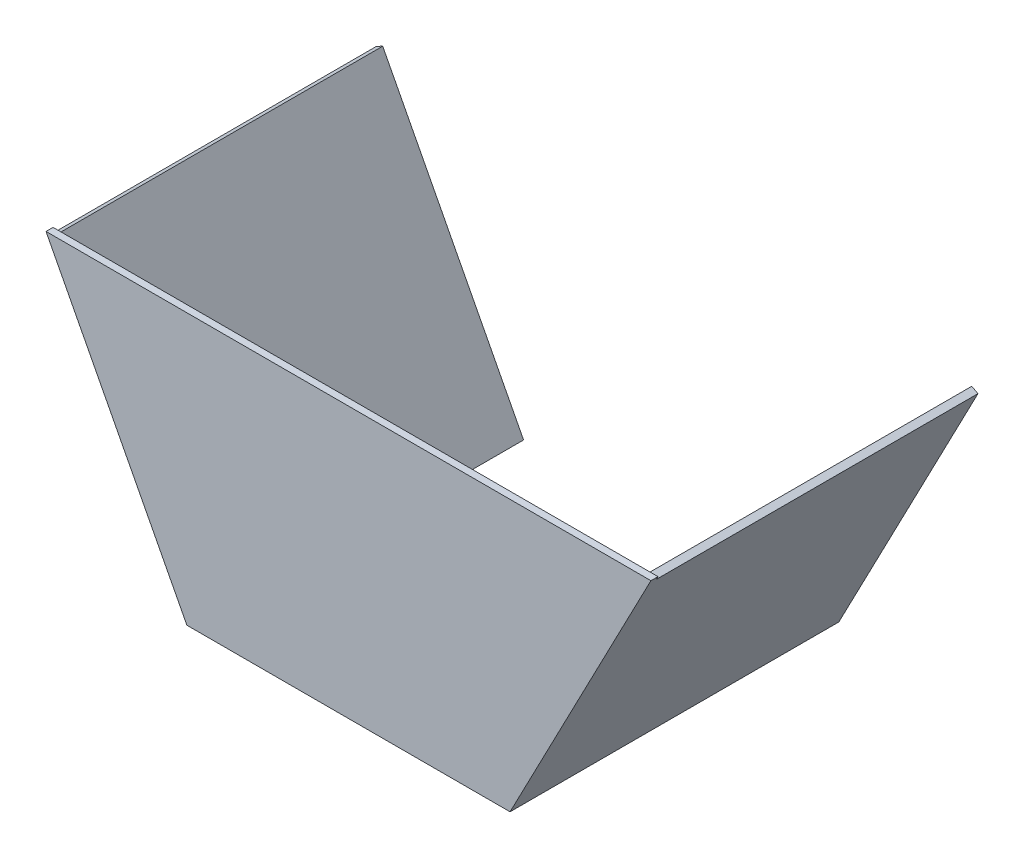
from build123d import *

# Parameters (mm, degrees)
BOSS_EXTRUDE1_DEPTH   = 290
BOSS_EXTRUDE1_2_DEPTH = 290
BOSS_EXTRUDE2_DEPTH   = 6.35


with BuildPart() as part:
    # Sketch1 → Boss-Extrude1 (new body)
    with BuildSketch(Plane.XY):
        Polygon((-138.5, 0), (-265.48086864, 243.927979124), (-271.11338743, 240.99587543), (-145.658875363, 0), align=None)
    extrude(amount=BOSS_EXTRUDE1_DEPTH)



with BuildPart() as body_2:
    # Sketch1 → Boss-Extrude1 2 (new body)
    with BuildSketch(Plane.XY):
        Polygon((138.5, 0), (265.48086864, 243.927979124), (271.11338743, 240.99587543), (145.658875363, 0), align=None)
    extrude(amount=BOSS_EXTRUDE1_2_DEPTH)


with BuildPart() as part_1:
    add(part.part)

    add(body_2.part)  # Boss-Extrude2 merges body 2
    # Sketch2 → Boss-Extrude2 (add)
    with BuildSketch(Plane.XY.offset(290)):
        Polygon((-145.658875363, 0), (-272.639744002, 243.927979124), (272.639744002, 243.927979124), (145.658875363, 0), align=None)
    extrude(amount=BOSS_EXTRUDE2_DEPTH)


solid = part_1.part
